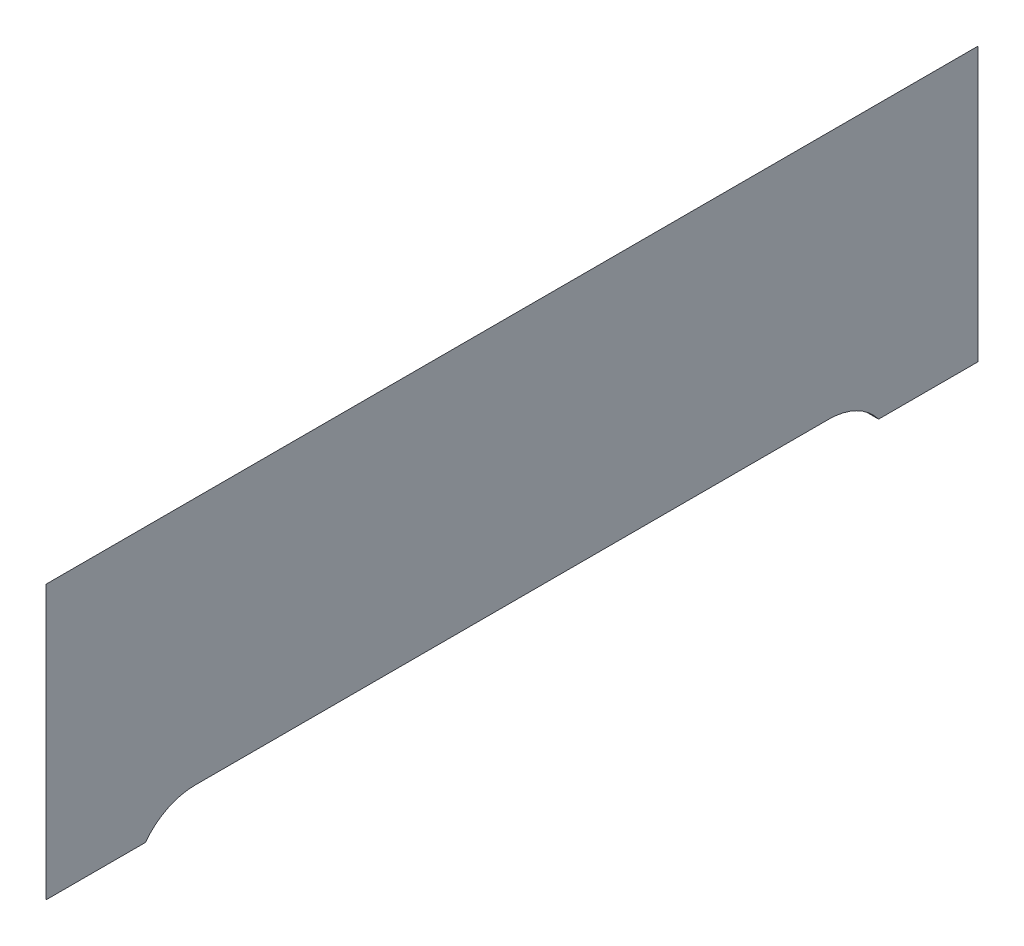
from build123d import *

# Parameters (mm, degrees)
BOSS_EXTRUDE1_DEPTH = 12
CHAMFER1_SIZE       = 12


with BuildPart() as part:
    # Sketch1 → Boss-Extrude1 (new body)
    with BuildSketch(Plane(origin=(0, 0, 0), x_dir=(0, 0, -1), z_dir=(1, 0, 0))):
        with BuildLine():
            Line((0, 0), (0, -10))
            Line((0, -10), (40, -10))
            ThreePointArc((40, -10), (48.819660113, -2.639320225), (60, 0))
            Line((60, 0), (315, 0))
            ThreePointArc((315, 0), (326.180339887, -2.639320225), (335, -10))
            Line((335, -10), (375, -10))
            Line((375, -10), (375, 0))
            Line((375, 0), (375, 100))
            Line((375, 100), (0, 100))
            Line((0, 100), (0, 0))
        make_face()
    extrude(amount=BOSS_EXTRUDE1_DEPTH)

    # Chamfer1
    chamfer1_edges = [part.edges().sort_by_distance(p)[0] for p in [
        (0, 45, -375),
        (0, 45, 0),
        (0, 100, -187.5),
    ]]
    chamfer(chamfer1_edges, length=CHAMFER1_SIZE - 0.0001)  # a hair under: the kernel refuses the full size


solid = part.part
